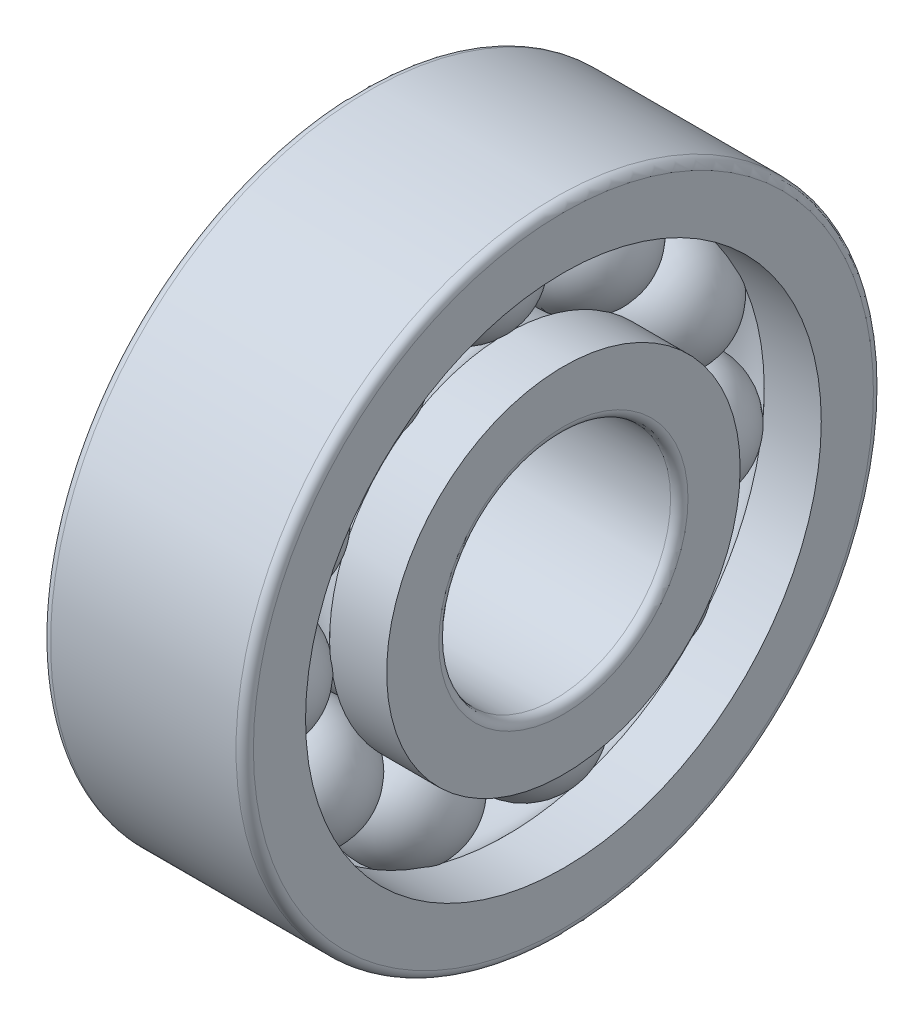
from build123d import *

# Parameters (mm, degrees)
CAGSPISKE_W         = 0.42
CAGSPISKE_H         = 0.7
CAGESPINE_ANGLE     = 0.001
BALLSDETAILED_COUNT = 11
BALLSDETAILED_ANGLE = 327.272727273


with BuildPart() as part:
    # CagSpiSke → CageSpine (revolve)
    with BuildSketch(Plane.XY):
        with Locations((0, 7.5)):
            Rectangle(CAGSPISKE_W, CAGSPISKE_H)
    revolve(axis=Axis((-20.6375, 0, 0), (-1, 0, 0)), revolution_arc=CAGESPINE_ANGLE)

    # BalDetSke → BallDetailed (revolve)
    with BuildSketch(Plane.XY):
        with BuildLine():
            Line((-2.1, 7.5), (2.1, 7.5))
            ThreePointArc((2.1, 7.5), (0, 5.4), (-2.1, 7.5))
        make_face()
    balldetailed = revolve(axis=Axis((-1.905, 7.5, 0), (1, 0, 0)))

    # InnRacSke → InnerRace (revolve)
    with BuildSketch(Plane.XY):
        with BuildLine():
            Line((-1.531543339, 6.1), (-3.5, 6.1))
            Line((-3.5, 6.1), (-3.5, 4.3))
            ThreePointArc((-3.5, 4.3), (-3.412132034, 4.087867966), (-3.2, 4))
            Line((-3.2, 4), (3.2, 4))
            ThreePointArc((3.2, 4), (3.412132034, 4.087867966), (3.5, 4.3))
            Line((3.5, 4.3), (3.5, 6.1))
            Line((3.5, 6.1), (1.531543339, 6.1))
            ThreePointArc((1.531543339, 6.1), (0, 5.425), (-1.531543339, 6.1))
        make_face()
    revolve(axis=Axis((-20.6375, 0, 0), (1, 0, 0)))

    # OutRacSke → OuterRace (revolve)
    with BuildSketch(Plane.XY):
        with BuildLine():
            Line((-1.531543339, 8.9), (-3.5, 8.9))
            Line((-3.5, 8.9), (-3.5, 10.7))
            ThreePointArc((-3.5, 10.7), (-3.412132034, 10.912132034), (-3.2, 11))
            Line((-3.2, 11), (3.2, 11))
            ThreePointArc((3.2, 11), (3.412132034, 10.912132034), (3.5, 10.7))
            Line((3.5, 10.7), (3.5, 8.9))
            Line((3.5, 8.9), (1.531543339, 8.9))
            ThreePointArc((1.531543339, 8.9), (0, 9.575), (-1.531543339, 8.9))
        make_face()
    revolve(axis=Axis((-20.6375, 0, 0), (1, 0, 0)))

    # BallsDetailed: BallDetailed ×11 about axis
    ballsdetailed_axis = Axis((-50, 0, 0), (1, 0, 0))
    for i in range(1, BALLSDETAILED_COUNT):
        add(balldetailed.rotate(ballsdetailed_axis, i * BALLSDETAILED_ANGLE / (BALLSDETAILED_COUNT - 1)))


solid = part.part
